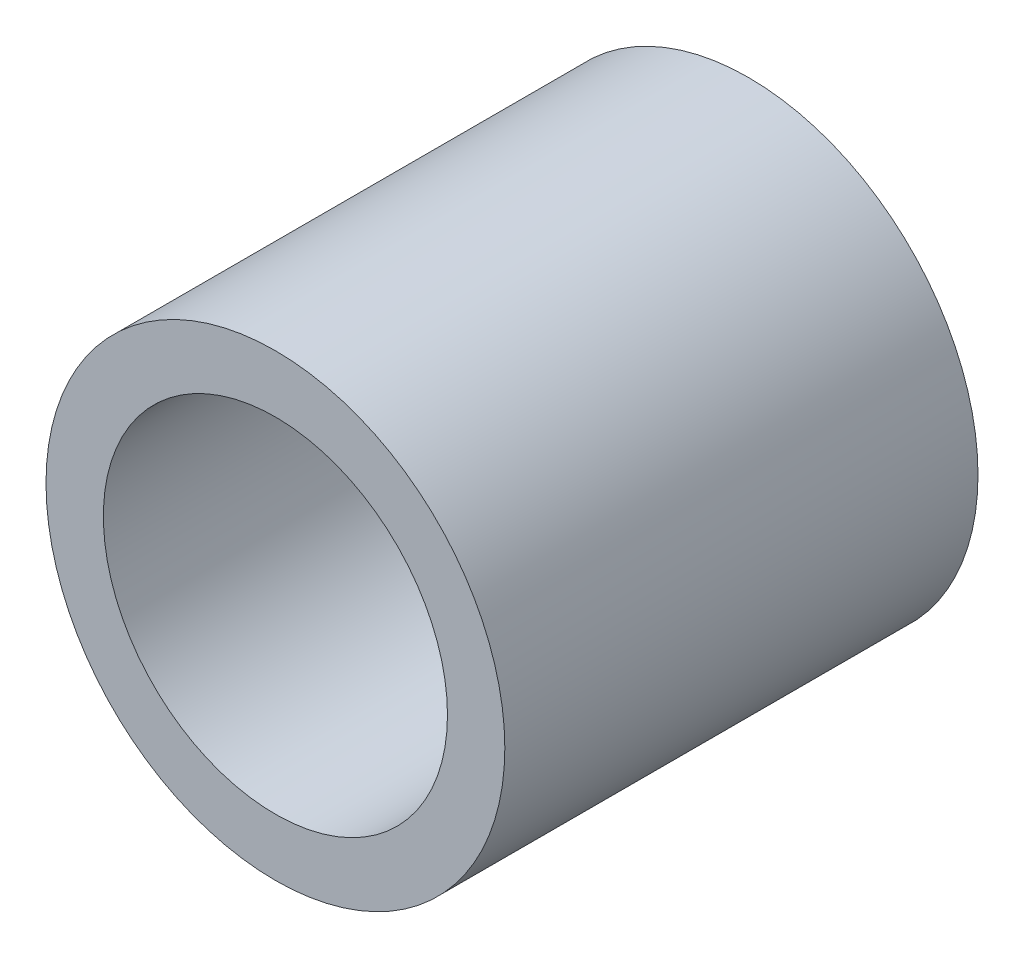
from build123d import *

# Parameters (mm, degrees)
SKETCH1_R           = 8
SKETCH1_R_2         = 6
BOSS_EXTRUDE1_DEPTH = 16.5


with BuildPart() as part:
    # Sketch1 → Boss-Extrude1 (new body)
    with BuildSketch(Plane.XY):
        Circle(SKETCH1_R)
        Circle(SKETCH1_R_2, mode=Mode.SUBTRACT)
    extrude(amount=BOSS_EXTRUDE1_DEPTH)


solid = part.part
